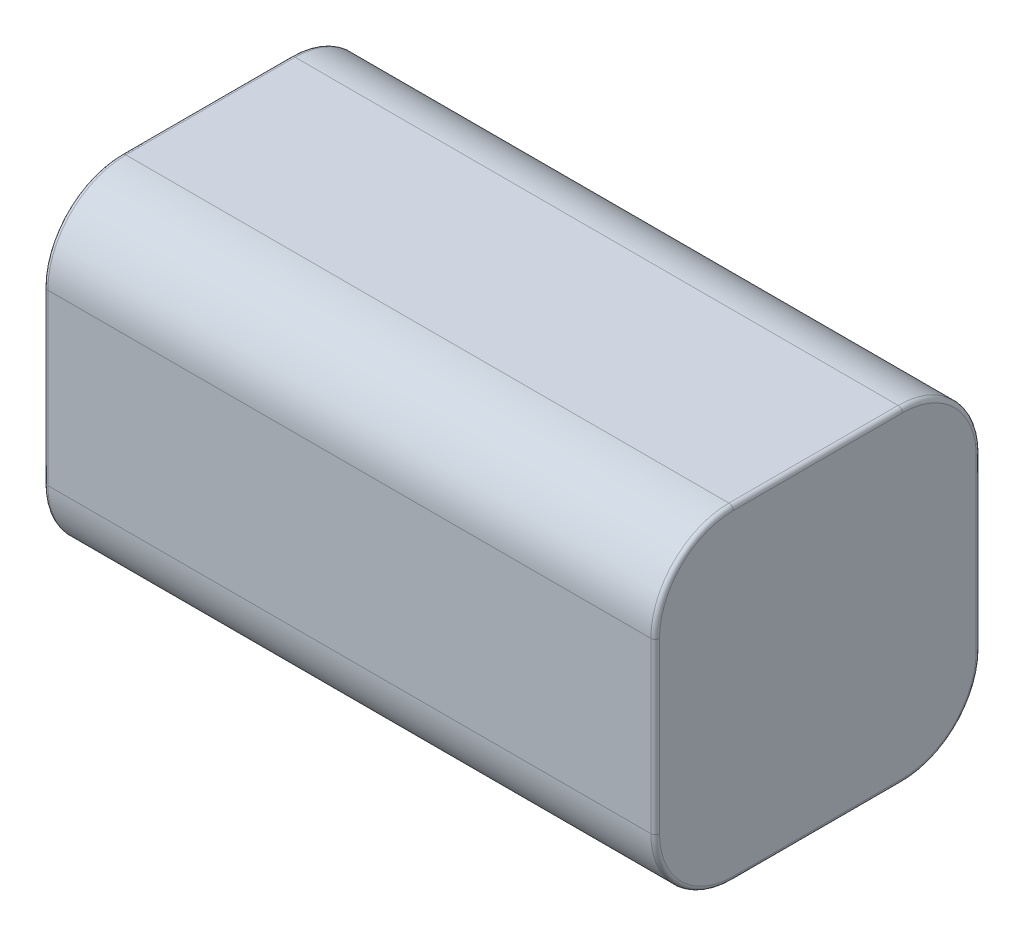
from build123d import *

# Parameters (mm, degrees)
SKETCH_1_W      = 37.5
SKETCH_1_H      = 37.5
EXTRUDE_1_DEPTH = 70.5
FILLET_1_R      = 9
FILLET_2_R      = 0.5


with BuildPart() as part:
    # 草图1 → 凸台-拉伸1 (new body)
    with BuildSketch(Plane(origin=(0, 0, 0), x_dir=(0, 0, -1), z_dir=(1, 0, 0))):
        with Locations((18.75, 18.75)):
            Rectangle(SKETCH_1_W, SKETCH_1_H)
    extrude(amount=EXTRUDE_1_DEPTH)

    # 圆角1
    fillet_1_edges = [part.edges().sort_by_distance(p)[0] for p in [
        (35.25, 0, -37.5),
        (35.25, 0, 0),
        (35.25, 37.5, -37.5),
        (35.25, 37.5, 0),
    ]]
    fillet(fillet_1_edges, radius=FILLET_1_R)

    # 圆角2
    fillet_2_edges = [part.edges().sort_by_distance(p)[0] for p in [
        (0, 34.863961031, -34.863961031),
        (0, 37.5, -18.75),
        (0, 34.863961031, -2.636038969),
        (0, 18.75, 0),
        (0, 2.636038969, -2.636038969),
        (0, 0, -18.75),
        (0, 2.636038969, -34.863961031),
        (0, 18.75, -37.5),
        (70.5, 2.636038969, -2.636038969),
        (70.5, 18.75, 0),
        (70.5, 34.863961031, -2.636038969),
        (70.5, 37.5, -18.75),
        (70.5, 34.863961031, -34.863961031),
        (70.5, 18.75, -37.5),
        (70.5, 2.636038969, -34.863961031),
        (70.5, 0, -18.75),
    ]]
    fillet(fillet_2_edges, radius=FILLET_2_R)


solid = part.part
